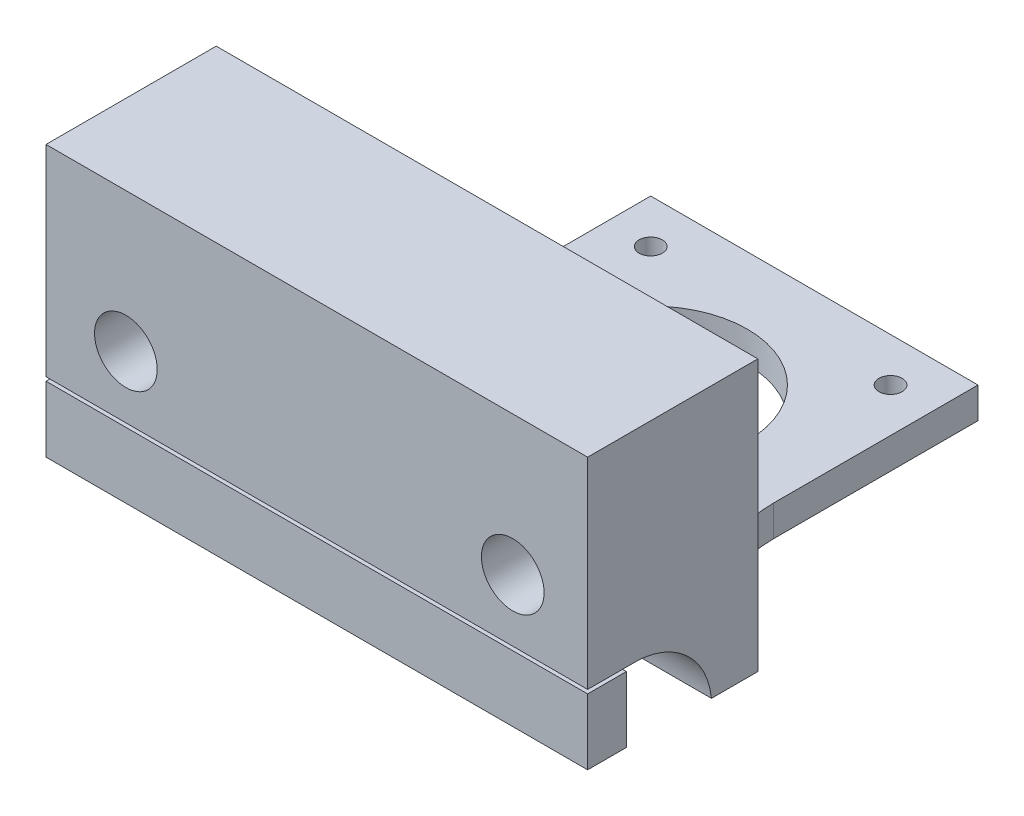
from build123d import *

# Parameters (mm, degrees)
SKETCH1_W           = 42.3
SKETCH1_H           = 42.3
SKETCH1_R           = 1.5
SKETCH1_R_2         = 12.5
BOSS_EXTRUDE1_DEPTH = 4
SKETCH2_W           = 70
SKETCH2_H           = 35
BOSS_EXTRUDE3_DEPTH = 6
SKETCH5_W           = 70
SKETCH5_H           = 26
SKETCH5_R           = 4.05
BOSS_EXTRUDE7_DEPTH = 16
CUT_EXTRUDE1_START  = -16
SKETCH5_2_R         = 4.05
CUT_EXTRUDE1_DEPTH  = 16
FILLET1_R           = 16
FILLET2_R           = 10
FILLET4_R           = 2
SKETCH6_W           = 70
SKETCH6_H           = 5
BOSS_EXTRUDE8_DEPTH = 8.5


with BuildPart() as part:
    # Sketch1 → Boss-Extrude1 (new body)
    with BuildSketch(Plane(origin=(0, 0, 0), x_dir=(1, 0, 0), z_dir=(0, 1, 0))):
        Rectangle(SKETCH1_W, SKETCH1_H)
        with Locations(Location((-15.5, 15.5, 0), (0, 0, 270))):
            Circle(SKETCH1_R, mode=Mode.SUBTRACT)
        with Locations(Location((15.5, 15.5, 0), (0, 0, 270))):
            Circle(SKETCH1_R, mode=Mode.SUBTRACT)
        with Locations(Location((15.5, -15.5, 0), (0, 0, 270))):
            Circle(SKETCH1_R, mode=Mode.SUBTRACT)
        with Locations(Location((-15.5, -15.5, 0), (0, 0, 270))):
            Circle(SKETCH1_R, mode=Mode.SUBTRACT)
        with Locations(Location((0, 0, 0), (0, 0, 270))):
            Circle(SKETCH1_R_2, mode=Mode.SUBTRACT)
    extrude(amount=BOSS_EXTRUDE1_DEPTH)

    # Sketch2 → Boss-Extrude3 (add)
    with BuildSketch(Plane.XY.offset(21.15)):
        with Locations((0, 17.5)):
            Rectangle(SKETCH2_W, SKETCH2_H)
    extrude(amount=BOSS_EXTRUDE3_DEPTH)

    # Sketch5 → Boss-Extrude7 (add)
    with BuildSketch(Plane.XY.offset(27.15)):
        with Locations((0, 22)):
            Rectangle(SKETCH5_W, SKETCH5_H)
        with Locations((-24.679036529, 17)):
            Circle(SKETCH5_R, mode=Mode.SUBTRACT)
        with Locations((25.320963471, 17)):
            Circle(SKETCH5_R, mode=Mode.SUBTRACT)
    extrude(amount=BOSS_EXTRUDE7_DEPTH)

    # Sketch5<2> → Cut-Extrude1 (cut)
    with BuildSketch(Plane.XY.offset(27.15).offset(CUT_EXTRUDE1_START)):
        with Locations((-24.679036529, 17)):
            Circle(SKETCH5_2_R)
        with Locations((25.320963471, 17)):
            Circle(SKETCH5_2_R)
    extrude(amount=CUT_EXTRUDE1_DEPTH, mode=Mode.SUBTRACT)

    # Fillet1
    # the kernel refuses this fillet: 16 mm, written as the material it adds along each edge
    with BuildSketch(Plane(origin=(21.15, 0, 21.15), x_dir=(1, 0, 0), z_dir=(0, 1, 0))) as fillet1_piece_1:
        with BuildLine():
            CenterArc((16, 15.854888836), FILLET1_R, 180, 82.27751927)
            Line((0, 15.854888836), (-0.32, 15.854888836))
            Line((-0.32, 15.854888836), (-0.32, 0))
            Line((-0.32, 0), (0, -0.32))
            ThreePointArc((0, -0.32), (6.925, -0.32), (13.807, -0.317097777))
            Line((13.807, -0.317097777), (13.85, 0))
        make_face()
    extrude(amount=4)
    with BuildSketch(Plane(origin=(-21.15, 0, 21.15), x_dir=(-1, 0, 0), z_dir=(0, 1, 0))) as fillet1_piece_2:
        with BuildLine():
            CenterArc((16, -15.854888836), FILLET1_R, 97.72248073, 82.27751927)
            Line((0, -15.854888836), (-0.32, -15.854888836))
            Line((-0.32, -15.854888836), (-0.32, 0))
            Line((-0.32, 0), (0, 0.32))
            ThreePointArc((0, 0.32), (6.925, 0.32), (13.807, 0.317097777))
            Line((13.807, 0.317097777), (13.85, 0))
        make_face()
    extrude(amount=4)

    # Fillet2
    # the kernel refuses this fillet: 10 mm, written as the material it adds along each edge
    with BuildSketch(Plane(origin=(35, 9, 27.15), x_dir=(0, 0, 1), z_dir=(-1, 0, 0))) as fillet2_piece_1:
        with BuildLine():
            CenterArc((9.949874371, -10), FILLET2_R, 90, 84.260829523)
            Line((0, -9), (-0.198997487, -8.98))
            ThreePointArc((-0.198997487, -8.98), (-0.2, -4.5), (-0.2, 0))
            Line((-0.2, 0), (0, 0.2))
            Line((0, 0.2), (9.949874371, 0.2))
            Line((9.949874371, 0.2), (9.949874371, 0))
        make_face()
    extrude(amount=70)

    # Fillet4
    # the kernel refuses this fillet: 2 mm, written as the material it adds along each edge
    with BuildSketch(Plane(origin=(-35, 4, 21.15), x_dir=(0, 1, 0), z_dir=(1, 0, 0))) as fillet4_piece_1_section:
        with BuildLine():
            CenterArc((FILLET4_R, -FILLET4_R), FILLET4_R, 90, 90)
            Line((0, -FILLET4_R), (0, 0))
            Line((0, 0), (FILLET4_R, 0))
        make_face()
    fillet4_piece_1 = extrude(amount=70, mode=Mode.PRIVATE)
    fillet4_piece_1 = fillet4_piece_1 - Plane(origin=(-37.15, 4.464640399, 5.295111164), x_dir=(-1, 0, 0), z_dir=(0, -1, 0)) * Cylinder(16, 148, mode=Mode.PRIVATE)
    fillet4_piece_1 = fillet4_piece_1 - Plane(origin=(37.15, 4.464640399, 5.295111164), x_dir=(1, 0, 0), z_dir=(0, -1, 0)) * Cylinder(16, 148, mode=Mode.PRIVATE)
    add(fillet4_piece_1)


with BuildPart() as body_2:
    # Sketch6 → Boss-Extrude8 (new body)
    with BuildSketch(Plane.XZ):
        with Locations((0, 40.65)):
            Rectangle(SKETCH6_W, SKETCH6_H)
    extrude(amount=-BOSS_EXTRUDE8_DEPTH)


solid = Compound([part.part, body_2.part])
